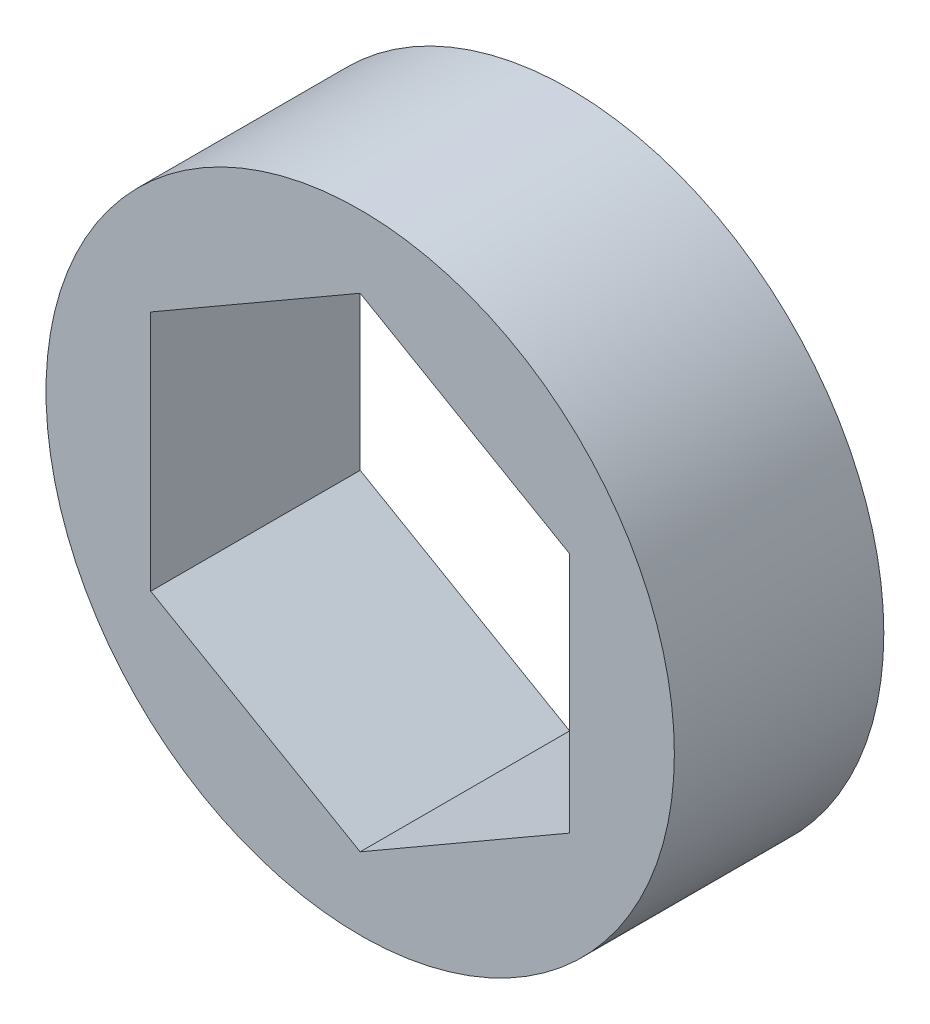
from build123d import *

# Parameters (mm, degrees)
SKETCH2_R           = 9.525
BOSS_EXTRUDE1_DEPTH = 6.35


with BuildPart() as part:
    # Sketch2 → Boss-Extrude1 (new body)
    with BuildSketch(Plane.XY):
        Circle(SKETCH2_R)
        Polygon((0, 7.332348419), (-6.35, 3.666174209), (-6.35, -3.666174209), (0, -7.332348419), (6.35, -3.666174209), (6.35, 3.666174209), align=None, mode=Mode.SUBTRACT)
    extrude(amount=BOSS_EXTRUDE1_DEPTH)


solid = part.part
